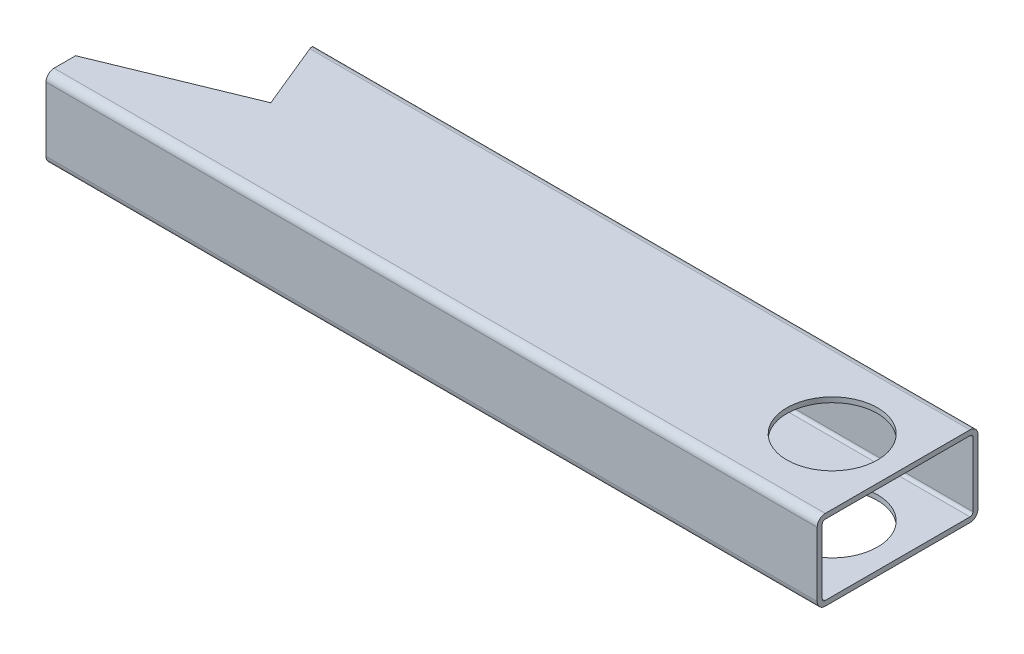
from build123d import *

# Parameters (mm, degrees)
EXTRUDE_THIN1_DEPTH     = 243.6368
CUT_EXTRUDE1_DEPTH      = 251.169323288
CUT_EXTRUDE1_DEPTH_BACK = 251.169323288
SKETCH4_R               = 14.3129


with BuildPart() as part:
    # Sketch1 → Extrude-Thin1 (new body)
    with BuildSketch(Plane(origin=(0, 0, 0), x_dir=(0, 0, -1), z_dir=(1, 0, 0))):
        with BuildLine():
            Line((-48.26, 25.4), (-2.54, 25.4))
            ThreePointArc((-2.54, 25.4), (-0.743948776, 24.656051224), (0, 22.86))
            Line((0, 22.86), (0, 2.54))
            ThreePointArc((0, 2.54), (-0.743948776, 0.743948776), (-2.54, 0))
            Line((-2.54, 0), (-48.26, 0))
            ThreePointArc((-48.26, 0), (-50.056051224, 0.743948776), (-50.8, 2.54))
            Line((-50.8, 2.54), (-50.8, 22.86))
            ThreePointArc((-50.8, 22.86), (-50.056051224, 24.656051224), (-48.26, 25.4))
        make_face()
        with BuildLine():
            Line((-48.26, 23.8125), (-2.54, 23.8125))
            ThreePointArc((-2.54, 23.8125), (-1.866480791, 23.533519209), (-1.5875, 22.86))
            Line((-1.5875, 22.86), (-1.5875, 2.54))
            ThreePointArc((-1.5875, 2.54), (-1.866480791, 1.866480791), (-2.54, 1.5875))
            Line((-2.54, 1.5875), (-48.26, 1.5875))
            ThreePointArc((-48.26, 1.5875), (-48.933519209, 1.866480791), (-49.2125, 2.54))
            Line((-49.2125, 2.54), (-49.2125, 22.86))
            ThreePointArc((-49.2125, 22.86), (-48.933519209, 23.533519209), (-48.26, 23.8125))
        make_face(mode=Mode.SUBTRACT)
    extrude(amount=-EXTRUDE_THIN1_DEPTH)

    # Sketch4 → Cut-Extrude1 (cut, two sides: drawn at the far end of the back side and taken through both)
    with BuildSketch(Plane(origin=(0, 25.4, 0), x_dir=(1, 0, 0), z_dir=(0, 1, 0)).offset(-CUT_EXTRUDE1_DEPTH_BACK)):
        with Locations((-20.6629, -25.4)):
            Circle(SKETCH4_R)
        Polygon((-209.5754, 0), (-199.924910127, -23.495277083), (-243.6368, -41.449572708), (-243.6368, 0), align=None)
    extrude(amount=CUT_EXTRUDE1_DEPTH + CUT_EXTRUDE1_DEPTH_BACK, mode=Mode.SUBTRACT)


solid = part.part
